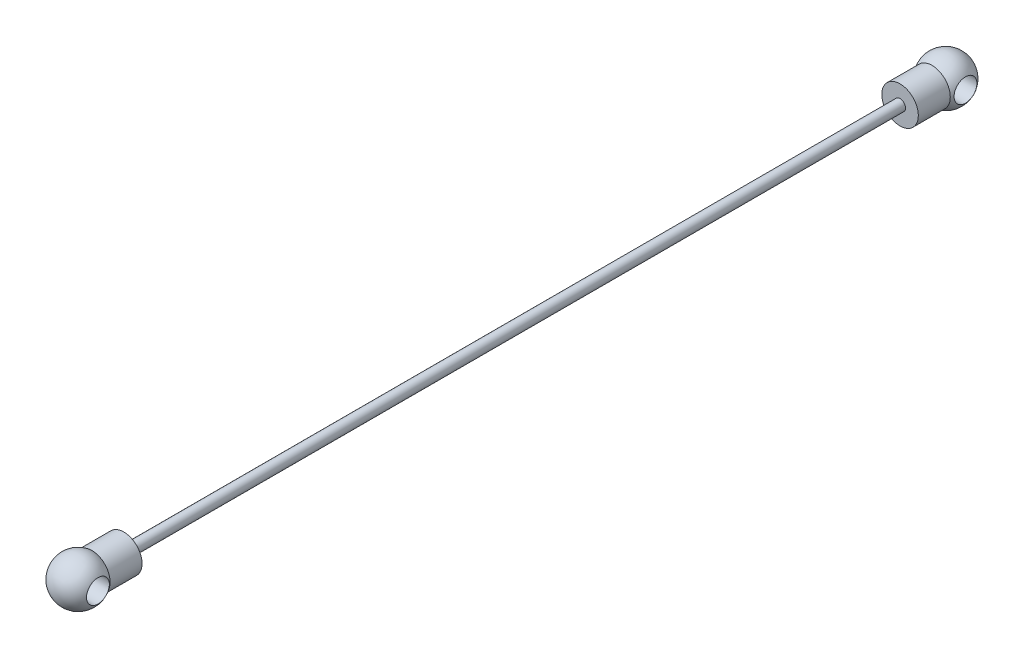
from build123d import *

# Parameters (mm, degrees)
SKETCH1_R           = 0.6
BOSS_EXTRUDE1_DEPTH = 42.5
SKETCH2_R           = 2
BOSS_EXTRUDE2_DEPTH = 5
SKETCH6_R           = 1.25
CUT_EXTRUDE2_DEPTH  = 51.124844139


with BuildPart() as part:
    # Sketch1 → Boss-Extrude1 (new, symmetric)
    with BuildSketch(Plane.XY):
        Circle(SKETCH1_R)
    extrude(amount=BOSS_EXTRUDE1_DEPTH, both=True)

    # Sketch2 → Boss-Extrude2 (add)
    with BuildSketch(Plane.XY.offset(42.5)):
        Circle(SKETCH2_R)
    boss_extrude2 = extrude(amount=BOSS_EXTRUDE2_DEPTH)

    # Sketch3 → Revolve1 (revolve)
    with BuildSketch(Plane(origin=(0, 0, 0), x_dir=(1, 0, 0), z_dir=(0, 1, 0))):
        with BuildLine():
            Line((0, -45), (0, -50))
            ThreePointArc((0, -50), (2.5, -47.5), (0, -45))
        make_face()
    revolve1 = revolve(axis=Axis((0, 0, 45), (0, 0, 1)))

    # Sketch6 → Cut-Extrude2 (cut, symmetric)
    with BuildSketch(Plane(origin=(0, 0, 0), x_dir=(0, 0, -1), z_dir=(1, 0, 0))):
        with Locations((-47.5, 0)):
            Circle(SKETCH6_R)
    cut_extrude2 = extrude(amount=CUT_EXTRUDE2_DEPTH, both=True, mode=Mode.SUBTRACT)

    # Mirror1: Boss-Extrude2, Revolve1, Cut-Extrude2 across plane
    add(boss_extrude2.mirror(Plane.XY))
    add(revolve1.mirror(Plane.XY))
    add(cut_extrude2.mirror(Plane.XY), mode=Mode.SUBTRACT)


solid = part.part
